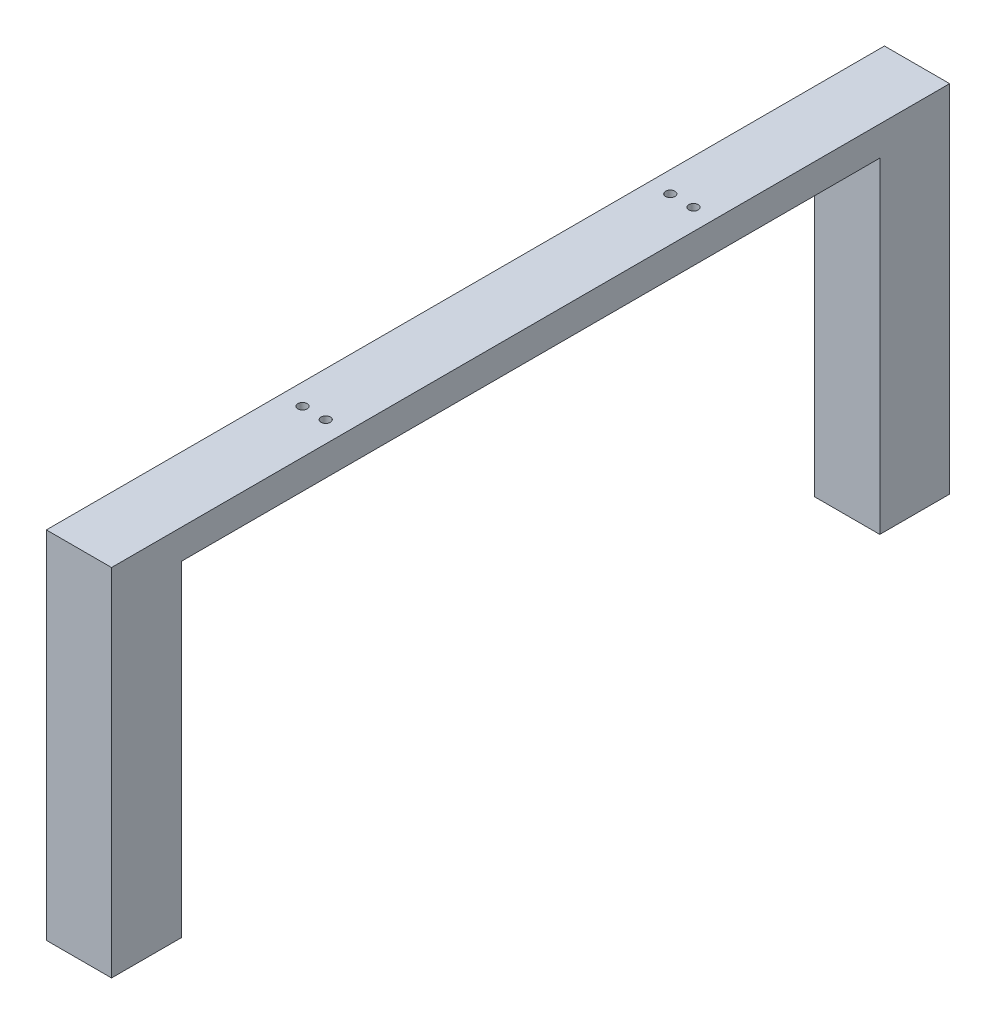
from build123d import *

# Parameters (mm, degrees)
BOSS_EXTRUDE1_DEPTH      = 7
BOSS_EXTRUDE1_DEPTH_BACK = 7
SKETCH2_R                = 1
CUT_EXTRUDE1_DEPTH       = 119.229956018


with BuildPart() as part:
    # Sketch1 → Boss-Extrude1 (new, two sides: drawn at the far end of the back side and taken through both)
    with BuildSketch(Plane(origin=(0, 0, 0), x_dir=(0, 0, -1), z_dir=(1, 0, 0)).offset(-BOSS_EXTRUDE1_DEPTH_BACK)):
        Polygon((-90, 0), (90, 0), (90, -76.35), (75, -76.35), (75, -6.35), (-75, -6.35), (-75, -76.35), (-90, -76.35), align=None)
    extrude(amount=BOSS_EXTRUDE1_DEPTH + BOSS_EXTRUDE1_DEPTH_BACK)

    # Sketch2 → Cut-Extrude1 (cut, through all)
    with BuildSketch(Plane(origin=(0, 0, 0), x_dir=(1, 0, 0), z_dir=(0, 1, 0))):
        with Locations((2.5, 39.5)):
            Circle(SKETCH2_R)
        with Locations((-2.5, 39.5)):
            Circle(SKETCH2_R)
        with Locations((2.5, -39.5)):
            Circle(SKETCH2_R)
        with Locations((-2.5, -39.5)):
            Circle(SKETCH2_R)
    extrude(amount=-CUT_EXTRUDE1_DEPTH, mode=Mode.SUBTRACT)


solid = part.part
